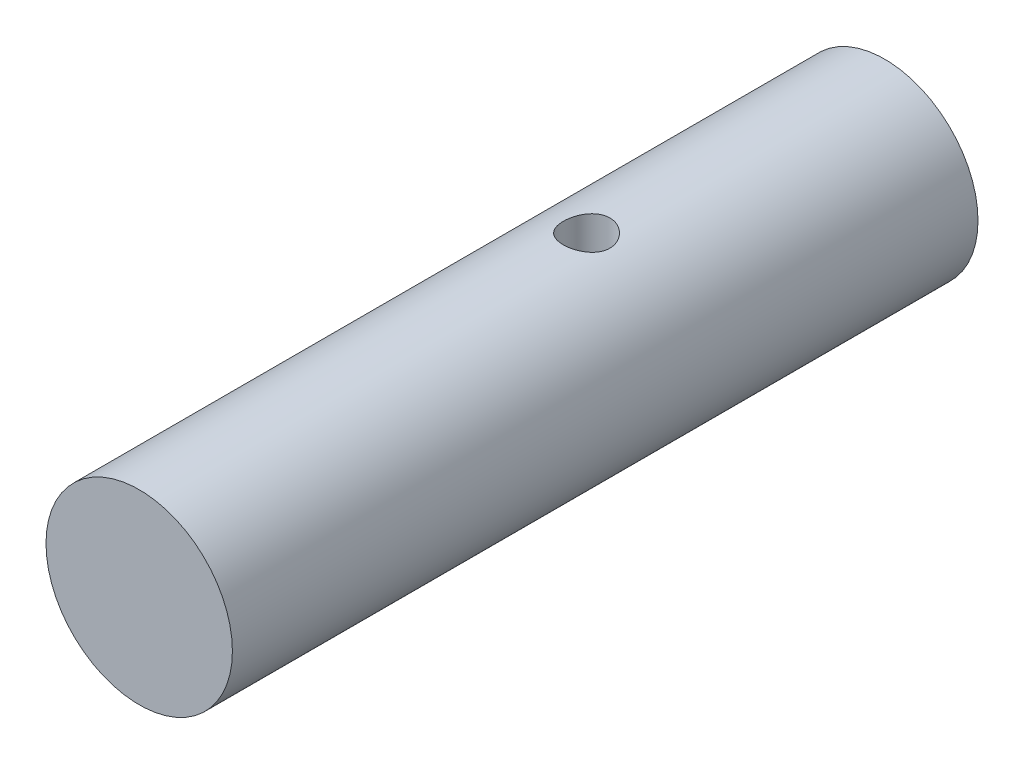
from build123d import *

# Parameters (mm, degrees)
SKETCH_2_R               = 5
EXTRUDE_1_DEPTH          = 40
CUT_EXTRUDE_1_DEPTH      = 41.620192023
CUT_EXTRUDE_1_DEPTH_BACK = 41.620192023
SKETCH_3_R               = 1.25


with BuildPart() as part:
    # ｽｹｯﾁ2 → ﾎﾞｽ - 押し出し1 (new body)
    with BuildSketch(Plane.XY):
        Circle(SKETCH_2_R)
    extrude(amount=EXTRUDE_1_DEPTH)

    # ｽｹｯﾁ3 → ｶｯﾄ - 押し出し1 (cut, two sides: drawn at the far end of the back side and taken through both)
    with BuildSketch(Plane(origin=(0, 0, 0), x_dir=(1, 0, 0), z_dir=(0, 1, 0)).offset(-CUT_EXTRUDE_1_DEPTH_BACK)):
        with Locations((0, -16)):
            Circle(SKETCH_3_R)
    extrude(amount=CUT_EXTRUDE_1_DEPTH + CUT_EXTRUDE_1_DEPTH_BACK, mode=Mode.SUBTRACT)


solid = part.part
